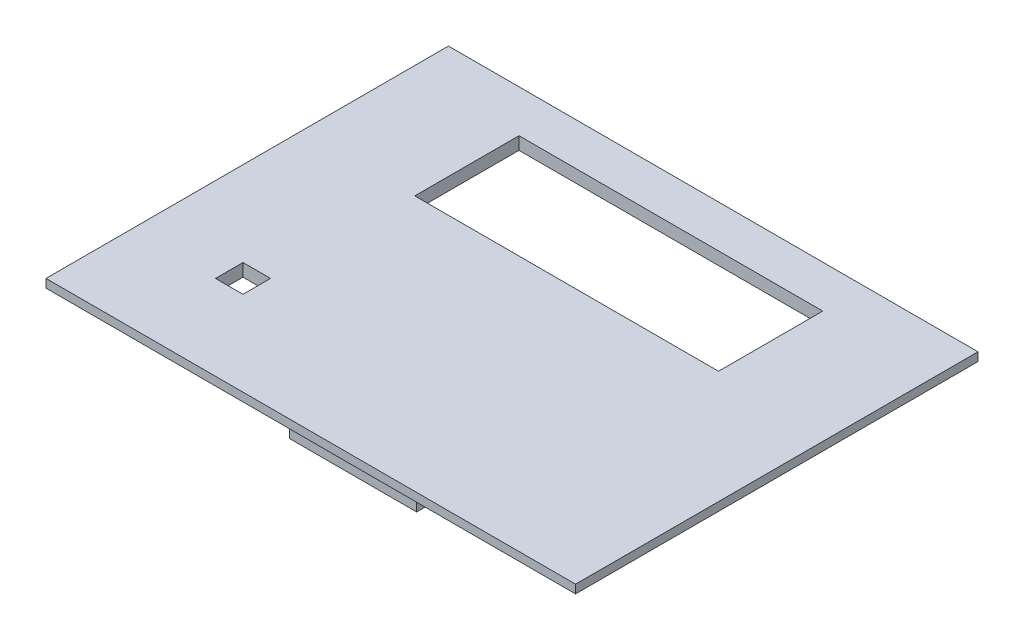
from build123d import *

# Parameters (mm, degrees)
ESBO_O1_W                = 115
ESBO_O1_H                = 85
RESSALTO_EXTRUS_O1_DEPTH = 1
ESBO_O2_W                = 125
ESBO_O2_H                = 95
RESSALTO_EXTRUS_O2_DEPTH = 2
ESBO_O3_W                = 71.7
ESBO_O3_H                = 24.6
ESBO_O3_W_2              = 6.5
ESBO_O3_H_2              = 6.5
CORTE_EXTRUS_O1_DEPTH    = 79.558895104
ESBO_O5_W                = 30
ESBO_O5_H                = 2
RESSALTO_EXTRUS_O3_DEPTH = 9
ESBO_O6_W                = 30
ESBO_O6_H                = 5
RESSALTO_EXTRUS_O4_DEPTH = 2


with BuildPart() as part:
    # Esboço1 → Ressalto-extrusão1 (new body)
    with BuildSketch(Plane(origin=(0, 0, 0), x_dir=(1, 0, 0), z_dir=(0, 1, 0))):
        Rectangle(ESBO_O1_W, ESBO_O1_H)
    extrude(amount=RESSALTO_EXTRUS_O1_DEPTH)

    # Esboço2 → Ressalto-extrusão2 (add)
    with BuildSketch(Plane(origin=(0, 1, 0), x_dir=(1, 0, 0), z_dir=(0, 1, 0))):
        Rectangle(ESBO_O2_W, ESBO_O2_H)
    extrude(amount=RESSALTO_EXTRUS_O2_DEPTH)

    # Esboço3 → Corte-extrusão1 (cut, through all)
    with BuildSketch(Plane(origin=(0, 3, 0), x_dir=(1, 0, 0), z_dir=(0, 1, 0))):
        with Locations((0, 25.2)):
            Rectangle(ESBO_O3_W, ESBO_O3_H)
        with Locations((-39.25, -24.25)):
            Rectangle(ESBO_O3_W_2, ESBO_O3_H_2)
    extrude(amount=-CORTE_EXTRUS_O1_DEPTH, mode=Mode.SUBTRACT)

    # Esboço5 → Ressalto-extrusão3 (add)
    with BuildSketch(Plane.XZ):
        with Locations((0, 36.5)):
            Rectangle(ESBO_O5_W, ESBO_O5_H)
        with Locations((0, -6.5)):
            Rectangle(ESBO_O5_W, ESBO_O5_H)
    extrude(amount=RESSALTO_EXTRUS_O3_DEPTH)

    # Esboço6 → Ressalto-extrusão4 (add)
    with BuildSketch(Plane(origin=(0, -9, 0), x_dir=(-1, 0, 0), z_dir=(0, -1, 0))):
        with Locations((0, -35)):
            Rectangle(ESBO_O6_W, ESBO_O6_H)
        with Locations((0, 5)):
            Rectangle(ESBO_O6_W, ESBO_O6_H)
    extrude(amount=RESSALTO_EXTRUS_O4_DEPTH)


solid = part.part
